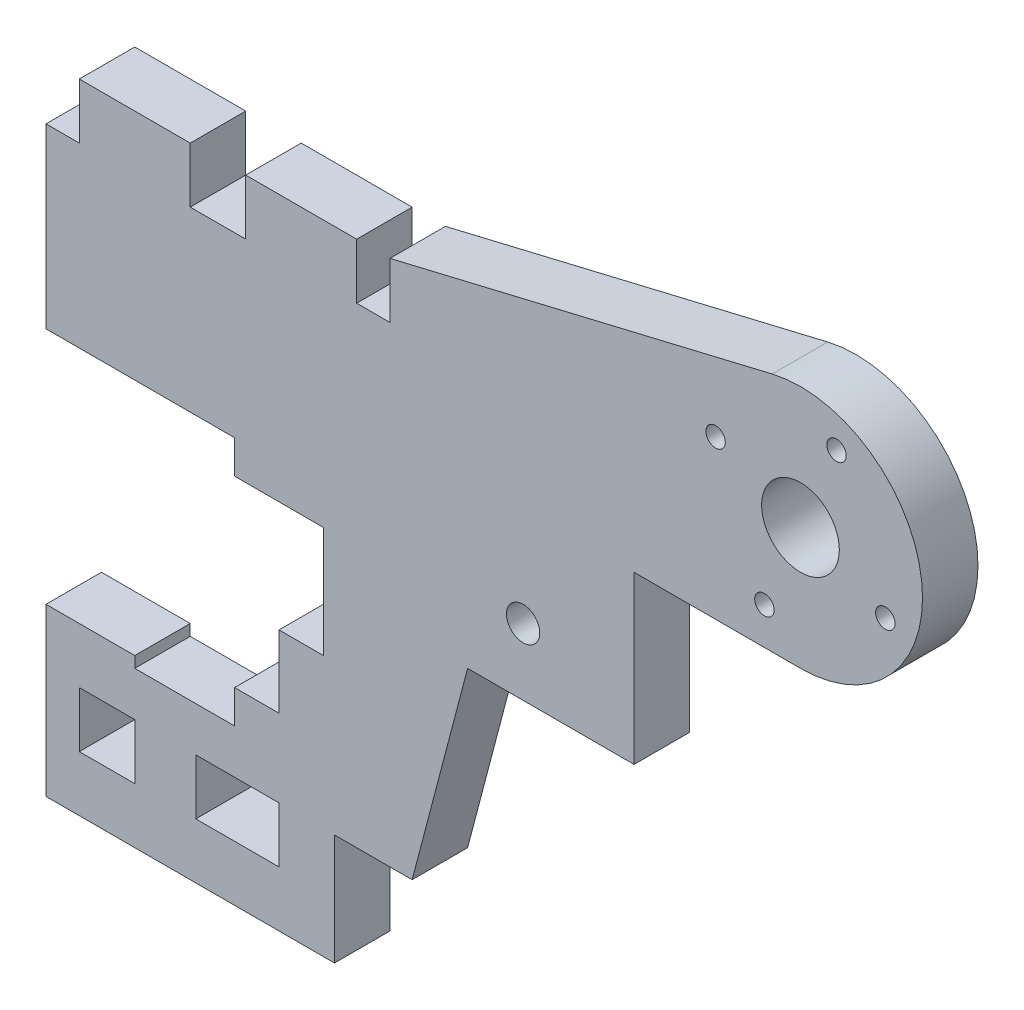
from build123d import *

# Parameters (mm, degrees)
ESQUISSE1_W        = 5
ESQUISSE1_H        = 5
ESQUISSE1_W_2      = 7.5
ESQUISSE1_R        = 1.5
ESQUISSE1_R_2      = 0.875
ESQUISSE1_R_3      = 3.5
BOSS_EXTRU_1_DEPTH = 5


with BuildPart() as part:
    # Esquisse1 → Boss.-Extru.1 (new body)
    with BuildSketch(Plane.XY):
        with BuildLine():
            Line((-8, 5), (-8, -10))
            Line((-8, -10), (18, -10))
            Line((18, -10), (18, 0))
            Line((18, 0), (25, 0))
            Line((25, 0), (30, 19))
            Line((30, 19), (45, 19))
            Line((45, 19), (45, 34))
            Line((45, 34), (60, 34))
            ThreePointArc((60, 34), (70.924996905, 46.282358225), (57.452770975, 55.701010433))
            Line((57.452770975, 55.701010433), (23, 47.5))
            Line((23, 47.5), (23, 42.5))
            Line((23, 42.5), (20, 42.5))
            Line((20, 42.5), (20, 47.5))
            Line((20, 47.5), (10, 47.5))
            Line((10, 47.5), (10, 42.5))
            Line((10, 42.5), (5, 42.5))
            Line((5, 42.5), (5, 47.5))
            Line((5, 47.5), (-5, 47.5))
            Line((-5, 47.5), (-5, 42.5))
            Line((-5, 42.5), (-8, 42.5))
            Line((-8, 42.5), (-8, 26.5))
            Line((-8, 26.5), (9, 26.5))
            Line((9, 26.5), (9, 23.5))
            Line((9, 23.5), (17, 23.5))
            Line((17, 23.5), (17, 13.5))
            Line((17, 13.5), (13, 13.5))
            Line((13, 13.5), (13, 7))
            Line((13, 7), (9, 7))
            Line((9, 7), (9, 4))
            Line((9, 4), (0, 4))
            Line((0, 4), (0, 5))
            Line((0, 5), (-8, 5))
        make_face()
        with Locations((-2.5, -2.5)):
            Rectangle(ESQUISSE1_W, ESQUISSE1_H, mode=Mode.SUBTRACT)
        with Locations((9.25, -2.5)):
            Rectangle(ESQUISSE1_W_2, ESQUISSE1_H, mode=Mode.SUBTRACT)
        with Locations((35, 25)):
            Circle(ESQUISSE1_R, mode=Mode.SUBTRACT)
        with Locations((56.75, 37.35)):
            Circle(ESQUISSE1_R_2, mode=Mode.SUBTRACT)
        with Locations((60, 45)):
            Circle(ESQUISSE1_R_3, mode=Mode.SUBTRACT)
        with Locations((67.65, 41.75)):
            Circle(ESQUISSE1_R_2, mode=Mode.SUBTRACT)
        with Locations((52.35, 48.25)):
            Circle(ESQUISSE1_R_2, mode=Mode.SUBTRACT)
        with Locations((63.25, 52.65)):
            Circle(ESQUISSE1_R_2, mode=Mode.SUBTRACT)
    extrude(amount=BOSS_EXTRU_1_DEPTH)


solid = part.part
